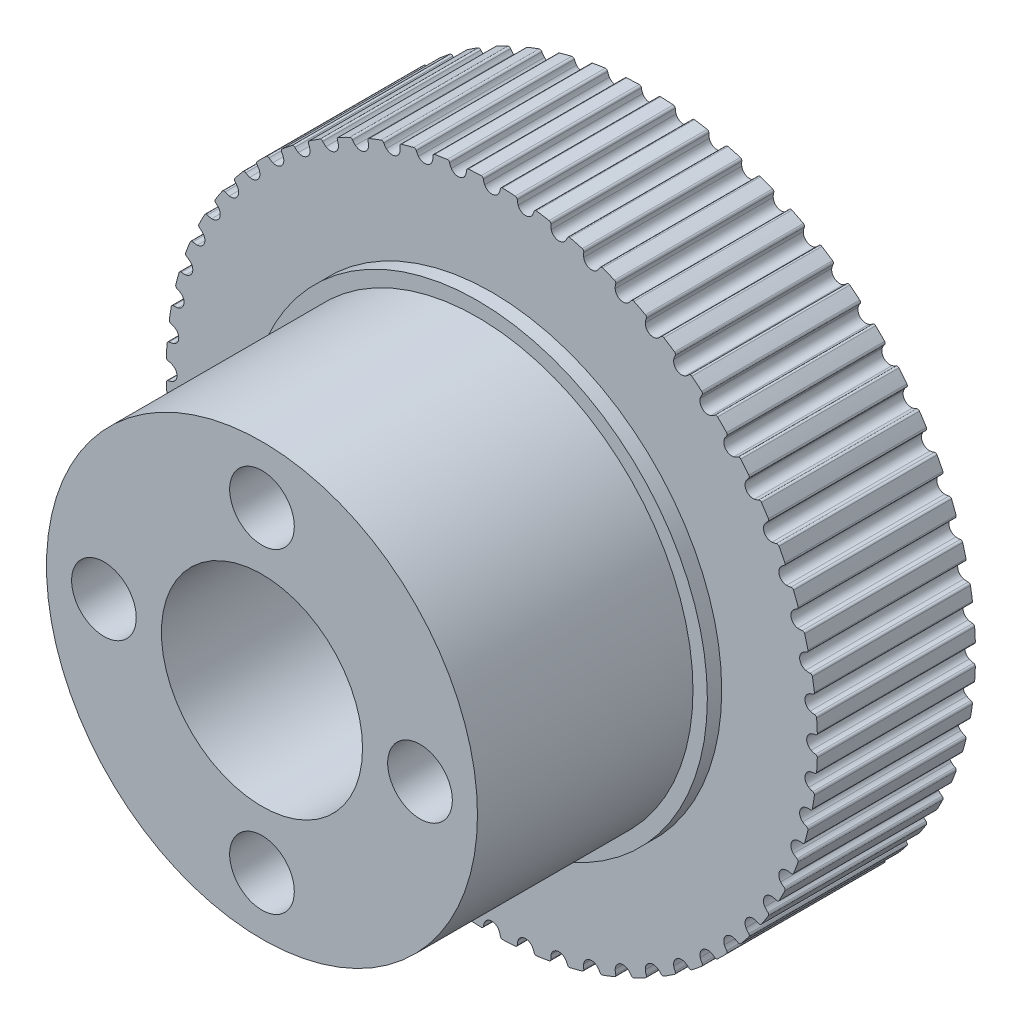
from build123d import *

# Parameters (mm, degrees)
SKETCH1_R           = 22.664311805
BOSS_EXTRUDE1_DEPTH = 5.5
CUT_EXTRUDE1_DEPTH  = 34.887196095
CIRPATTERN1_COUNT   = 60
SKETCH3_R           = 15
BOSS_EXTRUDE2_DEPTH = 16
SKETCH5_R           = 4
CUT_EXTRUDE2_DEPTH  = 42.895631971
SKETCH6_R           = 7
SKETCH6_R_2         = 2.25
CUT_EXTRUDE3_DEPTH  = 42.895631971
SKETCH7_R           = 3.6
CUT_EXTRUDE4_DEPTH  = 5
SKETCH8_R           = 16
BOSS_EXTRUDE3_DEPTH = 1


with BuildPart() as part:
    # Sketch1 → Boss-Extrude1 (new, symmetric)
    with BuildSketch(Plane.XY):
        Circle(SKETCH1_R)
    extrude(amount=BOSS_EXTRUDE1_DEPTH, both=True)

    # Sketch2 → Cut-Extrude1 (cut, through all)
    with BuildSketch(Plane.XY.offset(5.5)):
        with BuildLine():
            ThreePointArc((0, 22.664311805), (-0.371768134, 22.661262499), (-0.743436232, 22.652115402))
            ThreePointArc((-0.743436232, 22.652115402), (-0.642081483, 22.617089111), (-0.590013845, 22.523341646))
            ThreePointArc((-0.590013845, 22.523341646), (-0.556066589, 22.371162223), (-0.498876404, 22.226109558))
            ThreePointArc((-0.498876404, 22.226109558), (0, 21.914311805), (0.498876404, 22.226109558))
            ThreePointArc((0.498876404, 22.226109558), (0.556066589, 22.371162223), (0.590013845, 22.523341646))
            ThreePointArc((0.590013845, 22.523341646), (0.642081483, 22.617089111), (0.743436232, 22.652115402))
            ThreePointArc((0.743436232, 22.652115402), (0.371768134, 22.661262499), (0, 22.664311805))
        make_face()
    cut_extrude1 = extrude(amount=-CUT_EXTRUDE1_DEPTH, mode=Mode.SUBTRACT)

    # CirPattern1: Cut-Extrude1 ×60 about axis
    cirpattern1_axis = Axis((0, 0, 5.5), (0, 0, -1))
    for i in range(1, CIRPATTERN1_COUNT):
        add(cut_extrude1.rotate(cirpattern1_axis, i * 360 / CIRPATTERN1_COUNT), mode=Mode.SUBTRACT)

    # Sketch3 → Boss-Extrude2 (add)
    with BuildSketch(Plane.XY.offset(5.5)):
        Circle(SKETCH3_R)
    extrude(amount=BOSS_EXTRUDE2_DEPTH)

    # Sketch5 → Cut-Extrude2 (cut, through all)
    with BuildSketch(Plane.XY.offset(21.5)):
        Circle(SKETCH5_R)
    extrude(amount=-CUT_EXTRUDE2_DEPTH, mode=Mode.SUBTRACT)

    # Sketch6 → Cut-Extrude3 (cut, through all)
    with BuildSketch(Plane.XY.offset(21.5)):
        Circle(SKETCH6_R)
        with Locations((0, 11)):
            Circle(SKETCH6_R_2)
        with Locations((11, 0)):
            Circle(SKETCH6_R_2)
        with Locations((0, -11)):
            Circle(SKETCH6_R_2)
        with Locations((-11, 0)):
            Circle(SKETCH6_R_2)
    extrude(amount=-CUT_EXTRUDE3_DEPTH, mode=Mode.SUBTRACT)

    # Sketch7 → Cut-Extrude4 (cut)
    with BuildSketch(Plane(origin=(0, 0, -5.5), x_dir=(-1, 0, 0), z_dir=(0, 0, -1))):
        with Locations((0, 11)):
            Circle(SKETCH7_R)
        with Locations((11, 0)):
            Circle(SKETCH7_R)
        with Locations((-11, 0)):
            Circle(SKETCH7_R)
        with Locations((0, -11)):
            Circle(SKETCH7_R)
    extrude(amount=-CUT_EXTRUDE4_DEPTH, mode=Mode.SUBTRACT)

    # Sketch8 → Boss-Extrude3 (add)
    with BuildSketch(Plane.XY.offset(5.5)):
        Circle(SKETCH8_R)
    extrude(amount=BOSS_EXTRUDE3_DEPTH)


solid = part.part
